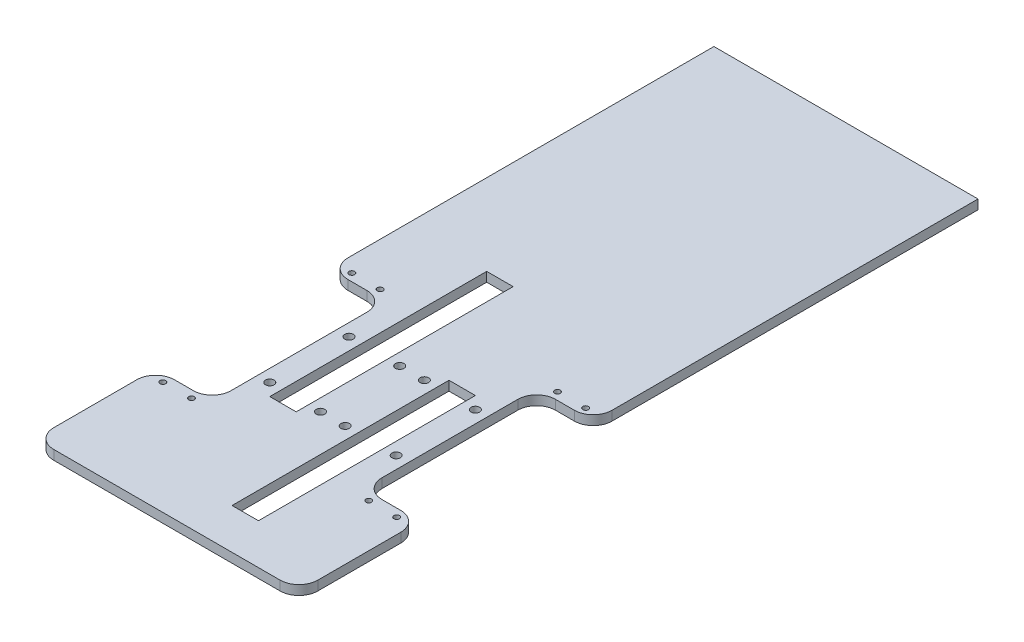
from build123d import *

# Parameters (mm, degrees)
SKETCH1_W           = 140
SKETCH1_H           = 340
BOSS_EXTRUDE1_DEPTH = 5
SKETCH3_W           = 30
SKETCH3_H           = 80
CUT_EXTRUDE1_DEPTH  = 184.915741577
SKETCH6_R           = 2.25
CUT_EXTRUDE2_DEPTH  = 184.915741577
SKETCH9_W           = 14
SKETCH9_H           = 55
CUT_EXTRUDE3_DEPTH  = 184.915741577
SKETCH10_W          = 14
SKETCH10_H          = 60
CUT_EXTRUDE4_DEPTH  = 184.915741577
SKETCH12_W          = 140
SKETCH12_H          = 20
BOSS_EXTRUDE2_DEPTH = 5
SKETCH14_R          = 1.5
CUT_EXTRUDE6_DEPTH  = 203.546291005
SKETCH15_W          = 30
SKETCH15_H          = 6
CUT_EXTRUDE7_DEPTH  = 203.546291005
FILLET1_R           = 10
FILLET2_R           = 10


with BuildPart() as part:
    # Sketch1 → Boss-Extrude1 (new body)
    with BuildSketch(Plane(origin=(0, 0, 0), x_dir=(1, 0, 0), z_dir=(0, 1, 0))):
        Rectangle(SKETCH1_W, SKETCH1_H)
    extrude(amount=BOSS_EXTRUDE1_DEPTH)

    # Sketch3 → Cut-Extrude1 (cut, through all)
    with BuildSketch(Plane(origin=(0, 5, 0), x_dir=(1, 0, 0), z_dir=(0, 1, 0))):
        with Locations((-55, -80)):
            Rectangle(SKETCH3_W, SKETCH3_H)
        with Locations((55, -80)):
            Rectangle(SKETCH3_W, SKETCH3_H)
    extrude(amount=-CUT_EXTRUDE1_DEPTH, mode=Mode.SUBTRACT)

    # Sketch6 → Cut-Extrude2 (cut, through all)
    with BuildSketch(Plane(origin=(0, 0, 0), x_dir=(-1, 0, 0), z_dir=(0, -1, 0))):
        with Locations((-33.5, -101.973028737)):
            Circle(SKETCH6_R)
        with Locations((-33.5, -59.973028737)):
            Circle(SKETCH6_R)
        with Locations((33.5, -101.973028737)):
            Circle(SKETCH6_R)
        with Locations((33.5, -59.973028737)):
            Circle(SKETCH6_R)
        with Locations((6.61862519, -101.973028737)):
            Circle(SKETCH6_R)
        with Locations((-6.446238439, -101.973028737)):
            Circle(SKETCH6_R)
        with Locations((6.61862519, -59.973028737)):
            Circle(SKETCH6_R)
        with Locations((-6.446238439, -59.973028737)):
            Circle(SKETCH6_R)
    extrude(amount=-CUT_EXTRUDE2_DEPTH, mode=Mode.SUBTRACT)

    # Sketch9 → Cut-Extrude3 (cut, through all)
    with BuildSketch(Plane.XZ):
        with Locations((-20, 80.973028737)):
            Rectangle(SKETCH9_W, SKETCH9_H)
        with Locations((20, 80.973028737)):
            Rectangle(SKETCH9_W, SKETCH9_H)
    extrude(amount=-CUT_EXTRUDE3_DEPTH, mode=Mode.SUBTRACT)

    # Sketch10 → Cut-Extrude4 (cut, through all)
    with BuildSketch(Plane(origin=(0, 5, 0), x_dir=(1, 0, 0), z_dir=(0, 1, 0))):
        with Locations((20, -138.473028737)):
            Rectangle(SKETCH10_W, SKETCH10_H)
        with Locations((-20, -23.473028737)):
            Rectangle(SKETCH10_W, SKETCH10_H)
    extrude(amount=-CUT_EXTRUDE4_DEPTH, mode=Mode.SUBTRACT)

    # Sketch12 → Boss-Extrude2 (add)
    with BuildSketch(Plane(origin=(0, 0, 0), x_dir=(1, 0, 0), z_dir=(0, 1, 0))):
        with Locations((0, -180)):
            Rectangle(SKETCH12_W, SKETCH12_H)
    extrude(amount=BOSS_EXTRUDE2_DEPTH)

    # Sketch14 → Cut-Extrude6 (cut, through all)
    with BuildSketch(Plane(origin=(0, 5, 0), x_dir=(1, 0, 0), z_dir=(0, 1, 0))):
        with Locations((-62, -30)):
            Circle(SKETCH14_R)
        with Locations((-47, -30)):
            Circle(SKETCH14_R)
        with Locations((47, -30)):
            Circle(SKETCH14_R)
        with Locations((62, -30)):
            Circle(SKETCH14_R)
        with Locations((-62, -130.169982871)):
            Circle(SKETCH14_R)
        with Locations((-47, -130)):
            Circle(SKETCH14_R)
        with Locations((47, -130)):
            Circle(SKETCH14_R)
        with Locations((62, -130.169982871)):
            Circle(SKETCH14_R)
    extrude(amount=-CUT_EXTRUDE6_DEPTH, mode=Mode.SUBTRACT)

    # Sketch15 → Cut-Extrude7 (cut, through all)
    with BuildSketch(Plane(origin=(0, 5, 0), x_dir=(1, 0, 0), z_dir=(0, 1, 0))):
        with Locations((-55, -37)):
            Rectangle(SKETCH15_W, SKETCH15_H)
        with Locations((-55, -123)):
            Rectangle(SKETCH15_W, SKETCH15_H)
        with Locations((55, -37)):
            Rectangle(SKETCH15_W, SKETCH15_H)
        with Locations((55, -123)):
            Rectangle(SKETCH15_W, SKETCH15_H)
    extrude(amount=-CUT_EXTRUDE7_DEPTH, mode=Mode.SUBTRACT)

    # Fillet1
    fillet1_edges = [part.edges().sort_by_distance(p)[0] for p in [
        (70, 2.5, 126),
        (70, 2.5, 34),
        (-70, 2.5, 126),
        (-70, 2.5, 34),
        (-70, 2.5, 190),
        (70, 2.5, 190),
    ]]
    fillet(fillet1_edges, radius=FILLET1_R)

    # Fillet2
    fillet2_edges = [part.edges().sort_by_distance(p)[0] for p in [
        (40, 2.5, 126),
        (40, 2.5, 34),
        (-40, 2.5, 126),
        (-40, 2.5, 34),
    ]]
    fillet(fillet2_edges, radius=FILLET2_R)


solid = part.part
